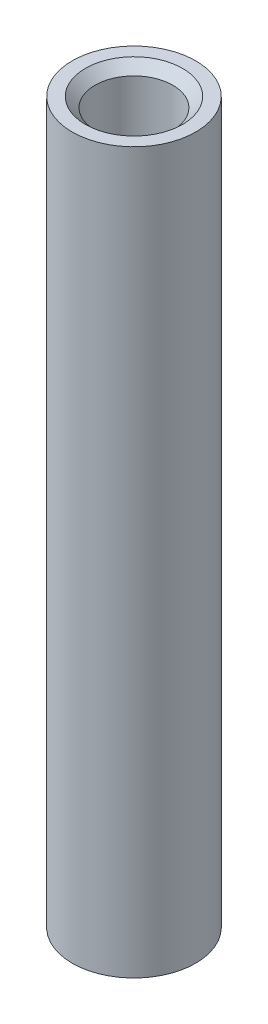
from build123d import *

# Parameters (mm, degrees)
SKETCH1_R           = 31.75
SKETCH1_R_2         = 20
BOSS_EXTRUDE1_DEPTH = 370.2
CHAMFER2_SIZE       = 5


with BuildPart() as part:
    # Sketch1 → Boss-Extrude1 (new body)
    with BuildSketch(Plane(origin=(0, 0, 0), x_dir=(1, 0, 0), z_dir=(0, 1, 0))):
        Circle(SKETCH1_R)
        Circle(SKETCH1_R_2, mode=Mode.SUBTRACT)
    extrude(amount=BOSS_EXTRUDE1_DEPTH)

    # Chamfer2
    chamfer2_edges = [part.edges().sort_by_distance(p)[0] for p in [
        (-20, 370.2, 0),
    ]]
    chamfer(chamfer2_edges, length=CHAMFER2_SIZE)


solid = part.part
